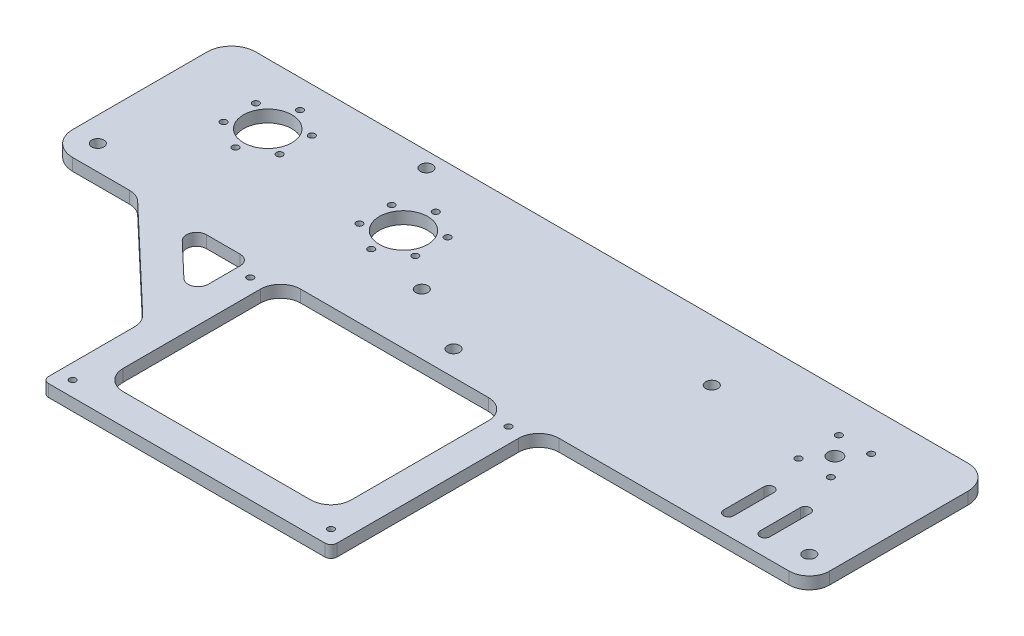
from build123d import *

# Parameters (mm, degrees)
ESBO_O1_R                = 1.6
ESBO_O1_R_2              = 3
ESBO_O1_R_3              = 12
ESBO_O1_R_4              = 3.5
RESSALTO_EXTRUS_O1_DEPTH = 6


with BuildPart() as part:
    # Esboço1 → Ressalto-extrusão1 (new body)
    with BuildSketch(Plane(origin=(0, 0, 0), x_dir=(1, 0, 0), z_dir=(0, 1, 0))):
        with BuildLine():
            Line((-85.527922956, -153.648697641), (51.472077044, -153.648697641))
            ThreePointArc((51.472077044, -153.648697641), (53.593397388, -152.770017984), (54.472077044, -150.648697641))
            Line((54.472077044, -150.648697641), (54.472077044, -108.102521344))
            Line((54.472077044, -108.102521344), (54.472077044, -60.648697641))
            ThreePointArc((54.472077044, -60.648697641), (57.401009232, -53.577629829), (64.472077044, -50.648697641))
            Line((64.472077044, -50.648697641), (178.527922956, -50.648697641))
            ThreePointArc((178.527922956, -50.648697641), (185.598990768, -47.719765453), (188.527922956, -40.648697641))
            Line((188.527922956, -40.648697641), (188.527922956, 28))
            ThreePointArc((188.527922956, 28), (185.01320433, 36.485281374), (176.527922956, 40))
            Line((176.527922956, 40), (-176.527922956, 40))
            ThreePointArc((-176.527922956, 40), (-185.01320433, 36.485281374), (-188.527922956, 28))
            Line((-188.527922956, 28), (-188.527922956, -38.648697641))
            ThreePointArc((-188.527922956, -38.648697641), (-185.01320433, -47.133979015), (-176.527922956, -50.648697641))
            Line((-176.527922956, -50.648697641), (-148.465622565, -50.648697641))
            ThreePointArc((-148.465622565, -50.648697641), (-144.756883762, -51.361865216), (-141.57713541, -53.399646343))
            Line((-141.57713541, -53.399646343), (-91.639435801, -100.853470046))
            ThreePointArc((-91.639435801, -100.853470046), (-89.338666415, -104.158213518), (-88.527922956, -108.102521344))
            Line((-88.527922956, -108.102521344), (-88.527922956, -150.648697641))
            ThreePointArc((-88.527922956, -150.648697641), (-87.649243299, -152.770017984), (-85.527922956, -153.648697641))
        make_face()
        with Locations((-81.027922956, -58.148697641)):
            Circle(ESBO_O1_R, mode=Mode.SUBTRACT)
        with Locations((-81.027922956, -146.148697641)):
            Circle(ESBO_O1_R, mode=Mode.SUBTRACT)
        with Locations((46.972077044, -58.148697641)):
            Circle(ESBO_O1_R, mode=Mode.SUBTRACT)
        with Locations((46.972077044, -146.148697641)):
            Circle(ESBO_O1_R, mode=Mode.SUBTRACT)
        with Locations((176.311042956, -38.431817641)):
            Circle(ESBO_O1_R_2, mode=Mode.SUBTRACT)
        with Locations((0, -38.431817641)):
            Circle(ESBO_O1_R_2, mode=Mode.SUBTRACT)
        with Locations((-140.527922956, 10)):
            Circle(ESBO_O1_R_3, mode=Mode.SUBTRACT)
        with Locations((-140.527922956, -6)):
            Circle(ESBO_O1_R, mode=Mode.SUBTRACT)
        with Locations((-154.384329416, 2)):
            Circle(ESBO_O1_R, mode=Mode.SUBTRACT)
        with Locations((-154.384329416, 18)):
            Circle(ESBO_O1_R, mode=Mode.SUBTRACT)
        with Locations((-84.367438628, 32.5)):
            Circle(ESBO_O1_R_2, mode=Mode.SUBTRACT)
        with Locations((-176.311042956, -38.431817641)):
            Circle(ESBO_O1_R_2, mode=Mode.SUBTRACT)
        with Locations((140.527922956, 10)):
            Circle(ESBO_O1_R_4, mode=Mode.SUBTRACT)
        with Locations((148.527922956, 0)):
            Circle(ESBO_O1_R, mode=Mode.SUBTRACT)
        with Locations((148.527922956, 20)):
            Circle(ESBO_O1_R, mode=Mode.SUBTRACT)
        with Locations((132.527922956, 0)):
            Circle(ESBO_O1_R, mode=Mode.SUBTRACT)
        with Locations((132.527922956, 20)):
            Circle(ESBO_O1_R, mode=Mode.SUBTRACT)
        with Locations((-140.527922956, 26)):
            Circle(ESBO_O1_R, mode=Mode.SUBTRACT)
        with Locations((-126.671516495, 18)):
            Circle(ESBO_O1_R, mode=Mode.SUBTRACT)
        with Locations((-126.671516495, 2)):
            Circle(ESBO_O1_R, mode=Mode.SUBTRACT)
        with Locations((-63.240442956, -16)):
            Circle(ESBO_O1_R, mode=Mode.SUBTRACT)
        with Locations((-77.096849416, -8)):
            Circle(ESBO_O1_R, mode=Mode.SUBTRACT)
        with Locations((-77.096849416, 8)):
            Circle(ESBO_O1_R, mode=Mode.SUBTRACT)
        with Locations((-63.240442956, 16)):
            Circle(ESBO_O1_R, mode=Mode.SUBTRACT)
        with Locations((-49.384036495, 8)):
            Circle(ESBO_O1_R, mode=Mode.SUBTRACT)
        with Locations((-49.384036495, -8)):
            Circle(ESBO_O1_R, mode=Mode.SUBTRACT)
        with Locations((-63.240442956, 0)):
            Circle(ESBO_O1_R_3, mode=Mode.SUBTRACT)
        with Locations((-33.527922956, -20.648697641)):
            Circle(ESBO_O1_R_2, mode=Mode.SUBTRACT)
        with Locations((79.527922956, 10)):
            Circle(ESBO_O1_R_2, mode=Mode.SUBTRACT)
        with BuildLine():
            Line((-110.176410786, -50.648697641), (-93.527922956, -50.648697641))
            ThreePointArc((-93.527922956, -50.648697641), (-89.99238905, -52.113163735), (-88.527922956, -55.648697641))
            Line((-88.527922956, -55.648697641), (-88.527922956, -71.469098112))
            ThreePointArc((-88.527922956, -71.469098112), (-91.555769043, -76.063726382), (-96.972166533, -75.09362376))
            Line((-96.972166533, -75.09362376), (-113.620654363, -59.27322329))
            ThreePointArc((-113.620654363, -59.27322329), (-114.819826998, -53.794328239), (-110.176410786, -50.648697641))
        make_face(mode=Mode.SUBTRACT)
        with BuildLine():
            Line((39.472077044, -60.648697641), (39.472077044, -128.648697641))
            ThreePointArc((39.472077044, -128.648697641), (36.543144856, -135.719765453), (29.472077044, -138.648697641))
            Line((29.472077044, -138.648697641), (-63.527922956, -138.648697641))
            ThreePointArc((-63.527922956, -138.648697641), (-70.598990768, -135.719765453), (-73.527922956, -128.648697641))
            Line((-73.527922956, -128.648697641), (-73.527922956, -60.648697641))
            ThreePointArc((-73.527922956, -60.648697641), (-70.598990768, -53.577629829), (-63.527922956, -50.648697641))
            Line((-63.527922956, -50.648697641), (29.472077044, -50.648697641))
            ThreePointArc((29.472077044, -50.648697641), (36.543144856, -53.577629829), (39.472077044, -60.648697641))
        make_face(mode=Mode.SUBTRACT)
        with BuildLine():
            Line((154.027922956, -40.648697641), (154.027922956, -20.648697641))
            ThreePointArc((154.027922956, -20.648697641), (156.527922956, -18.148697641), (159.027922956, -20.648697641))
            Line((159.027922956, -20.648697641), (159.027922956, -40.648697641))
            ThreePointArc((159.027922956, -40.648697641), (156.527922956, -43.148697641), (154.027922956, -40.648697641))
        make_face(mode=Mode.SUBTRACT)
        with BuildLine():
            Line((141.027922956, -40.648697641), (141.027922956, -20.648697641))
            ThreePointArc((141.027922956, -20.648697641), (138.527922956, -18.148697641), (136.027922956, -20.648697641))
            Line((136.027922956, -20.648697641), (136.027922956, -40.648697641))
            ThreePointArc((136.027922956, -40.648697641), (138.527922956, -43.148697641), (141.027922956, -40.648697641))
        make_face(mode=Mode.SUBTRACT)
    extrude(amount=-RESSALTO_EXTRUS_O1_DEPTH)


solid = part.part
